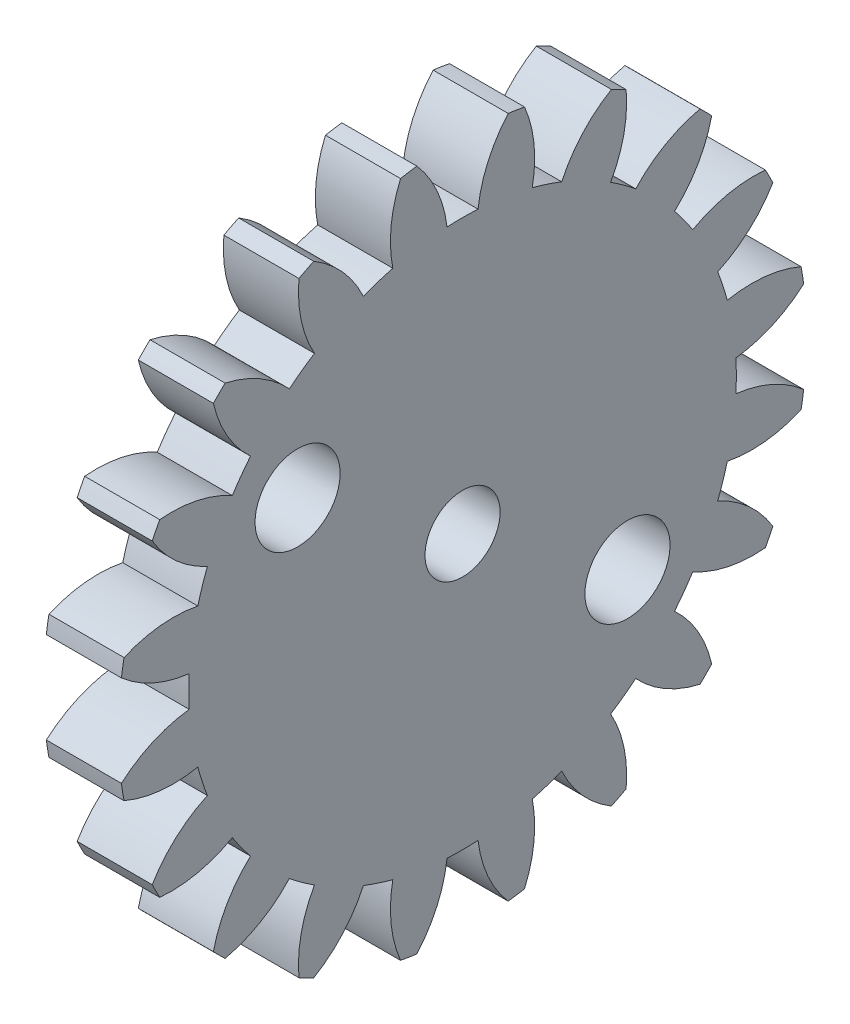
from build123d import *

# Parameters (mm, degrees)
SPUR_START             = -34.654843931
SPUR_GEAR_AM_OUTLINE_R = 5
SPUR_GEAR_AM_DEPTH     = 6
BOSS_EXTRUDE1_START    = -6
SKETCH2_R              = 5
SKETCH2_R_2            = 3
BOSS_EXTRUDE1_DEPTH    = 6
CUT_EXTRUDE1_REACH     = 65.242
SKETCH3_R              = 3.4


# Read off the part's stored shape, not the designer's step: spur gear_am
with BuildPart() as part:
    # spur gear_am outline → spur gear_am (new body)
    with BuildSketch(Plane.YZ.offset(SPUR_START)):
        with BuildLine():
            ThreePointArc((-3.907949552, 51.357822977), (-4.560317936, 51.46921073), (-5.215177847, 51.564867598))
            ThreePointArc((-5.215177847, 51.564867598), (-6.830693003, 49.038493172), (-7.624540457, 46.146735372))
            ThreePointArc((-7.624540457, 46.146735372), (-8.862265725, 46.181781364), (-10.099990992, 46.146735372))
            ThreePointArc((-10.099990992, 46.146735372), (-10.893838446, 49.038493172), (-12.509353602, 51.564867598))
            ThreePointArc((-12.509353602, 51.564867598), (-13.164213513, 51.46921073), (-13.816581897, 51.357822977))
            ThreePointArc((-13.816581897, 51.357822977), (-14.572335481, 48.455876478), (-14.433726972, 45.460339024))
            ThreePointArc((-14.433726972, 45.460339024), (-15.62170346, 45.111191601), (-16.788020333, 44.69538274))
            ThreePointArc((-16.788020333, 44.69538274), (-18.436616432, 47.200295486), (-20.75375528, 49.103798708))
            ThreePointArc((-20.75375528, 49.103798708), (-21.347004468, 48.810460779), (-21.933022961, 48.502931813))
            ThreePointArc((-21.933022961, 48.502931813), (-21.755036547, 45.509475985), (-20.69754004, 42.703382954))
            ThreePointArc((-20.69754004, 42.703382954), (-21.719480333, 42.004219099), (-22.700221591, 41.248349637))
            ThreePointArc((-22.700221591, 41.248349637), (-25.042190262, 43.121219015), (-27.834135107, 44.215522876))
            ThreePointArc((-27.834135107, 44.215522876), (-28.307702207, 43.753217846), (-28.770007237, 43.279650746))
            ThreePointArc((-28.770007237, 43.279650746), (-27.675703376, 40.487705901), (-25.802833998, 38.145737231))
            ThreePointArc((-25.802833998, 38.145737231), (-26.558703459, 37.164995972), (-27.257867315, 36.143055679))
            ThreePointArc((-27.257867315, 36.143055679), (-30.063960346, 37.200552186), (-33.057416174, 37.3785386))
            ThreePointArc((-33.057416174, 37.3785386), (-33.36494514, 36.792520107), (-33.658283069, 36.199270919))
            ThreePointArc((-33.658283069, 36.199270919), (-31.754779846, 33.882132071), (-29.249867101, 32.233535972))
            ThreePointArc((-29.249867101, 32.233535972), (-29.665675962, 31.067219099), (-30.014823385, 29.879242611))
            ThreePointArc((-30.014823385, 29.879242611), (-33.010360839, 30.01785112), (-35.912307338, 29.262097536))
            ThreePointArc((-35.912307338, 29.262097536), (-36.023695091, 28.609729152), (-36.119351959, 27.954869241))
            ThreePointArc((-36.119351959, 27.954869241), (-33.592977533, 26.339354085), (-30.701219732, 25.545506631))
            ThreePointArc((-30.701219732, 25.545506631), (-30.736265724, 24.307781363), (-30.701219732, 23.070056096))
            ThreePointArc((-30.701219732, 23.070056096), (-33.592977533, 22.276208642), (-36.119351959, 20.660693486))
            ThreePointArc((-36.119351959, 20.660693486), (-36.023695091, 20.005833575), (-35.912307338, 19.353465191))
            ThreePointArc((-35.912307338, 19.353465191), (-33.010360839, 18.597711607), (-30.014823385, 18.736320117))
            ThreePointArc((-30.014823385, 18.736320117), (-29.665675962, 17.548343629), (-29.249867101, 16.382026755))
            ThreePointArc((-29.249867101, 16.382026755), (-31.754779846, 14.733430656), (-33.658283069, 12.416291808))
            ThreePointArc((-33.658283069, 12.416291808), (-33.36494514, 11.82304262), (-33.057416174, 11.237024127))
            ThreePointArc((-33.057416174, 11.237024127), (-30.063960346, 11.415010541), (-27.257867315, 12.472507048))
            ThreePointArc((-27.257867315, 12.472507048), (-26.558703459, 11.450566755), (-25.802833998, 10.469825497))
            ThreePointArc((-25.802833998, 10.469825497), (-27.675703376, 8.127856826), (-28.770007237, 5.335911981))
            ThreePointArc((-28.770007237, 5.335911981), (-28.307702207, 4.862344881), (-27.834135107, 4.400039851))
            ThreePointArc((-27.834135107, 4.400039851), (-25.042190262, 5.494343712), (-22.700221591, 7.36721309))
            ThreePointArc((-22.700221591, 7.36721309), (-21.719480333, 6.611343629), (-20.69754004, 5.912179773))
            ThreePointArc((-20.69754004, 5.912179773), (-21.755036547, 3.106086742), (-21.933022961, 0.112630914))
            ThreePointArc((-21.933022961, 0.112630914), (-21.347004468, -0.194898052), (-20.75375528, -0.488235981))
            ThreePointArc((-20.75375528, -0.488235981), (-18.436616432, 1.415267242), (-16.788020333, 3.920179987))
            ThreePointArc((-16.788020333, 3.920179987), (-15.62170346, 3.504371126), (-14.433726972, 3.155223703))
            ThreePointArc((-14.433726972, 3.155223703), (-14.572335481, 0.159686249), (-13.816581897, -2.742260249))
            ThreePointArc((-13.816581897, -2.742260249), (-13.164213513, -2.853648003), (-12.509353602, -2.949304871))
            ThreePointArc((-12.509353602, -2.949304871), (-10.893838446, -0.422930445), (-10.099990992, 2.468827356))
            ThreePointArc((-10.099990992, 2.468827356), (-8.862265725, 2.433781364), (-7.624540457, 2.468827356))
            ThreePointArc((-7.624540457, 2.468827356), (-6.830693003, -0.422930445), (-5.215177847, -2.949304871))
            ThreePointArc((-5.215177847, -2.949304871), (-4.560317936, -2.853648003), (-3.907949552, -2.742260249))
            ThreePointArc((-3.907949552, -2.742260249), (-3.152195968, 0.159686249), (-3.290804477, 3.155223703))
            ThreePointArc((-3.290804477, 3.155223703), (-2.102827989, 3.504371126), (-0.936511116, 3.920179987))
            ThreePointArc((-0.936511116, 3.920179987), (0.712084983, 1.415267242), (3.029223831, -0.488235981))
            ThreePointArc((3.029223831, -0.488235981), (3.622473019, -0.194898052), (4.208491512, 0.112630914))
            ThreePointArc((4.208491512, 0.112630914), (4.030505098, 3.106086742), (2.973008591, 5.912179773))
            ThreePointArc((2.973008591, 5.912179773), (3.994948884, 6.611343629), (4.975690142, 7.36721309))
            ThreePointArc((4.975690142, 7.36721309), (7.317658813, 5.494343712), (10.109603658, 4.400039851))
            ThreePointArc((10.109603658, 4.400039851), (10.583170758, 4.862344881), (11.045475788, 5.335911981))
            ThreePointArc((11.045475788, 5.335911981), (9.951171927, 8.127856826), (8.078302549, 10.469825497))
            ThreePointArc((8.078302549, 10.469825497), (8.83417201, 11.450566755), (9.533335866, 12.472507048))
            ThreePointArc((9.533335866, 12.472507048), (12.339428897, 11.415010541), (15.332884725, 11.237024127))
            ThreePointArc((15.332884725, 11.237024127), (15.640413691, 11.82304262), (15.93375162, 12.416291808))
            ThreePointArc((15.93375162, 12.416291808), (14.030248397, 14.733430656), (11.525335652, 16.382026755))
            ThreePointArc((11.525335652, 16.382026755), (11.941144513, 17.548343629), (12.290291936, 18.736320117))
            ThreePointArc((12.290291936, 18.736320117), (15.28582939, 18.597711607), (18.187775889, 19.353465191))
            ThreePointArc((18.187775889, 19.353465191), (18.299163642, 20.005833575), (18.39482051, 20.660693486))
            ThreePointArc((18.39482051, 20.660693486), (15.868446084, 22.276208642), (12.976688283, 23.070056096))
            ThreePointArc((12.976688283, 23.070056096), (13.011734276, 24.307781363), (12.976688283, 25.545506631))
            ThreePointArc((12.976688283, 25.545506631), (15.868446084, 26.339354085), (18.39482051, 27.954869241))
            ThreePointArc((18.39482051, 27.954869241), (18.299163642, 28.609729152), (18.187775889, 29.262097536))
            ThreePointArc((18.187775889, 29.262097536), (15.28582939, 30.01785112), (12.290291936, 29.879242611))
            ThreePointArc((12.290291936, 29.879242611), (11.941144513, 31.067219099), (11.525335652, 32.233535972))
            ThreePointArc((11.525335652, 32.233535972), (14.030248397, 33.882132071), (15.93375162, 36.199270919))
            ThreePointArc((15.93375162, 36.199270919), (15.640413691, 36.792520107), (15.332884725, 37.3785386))
            ThreePointArc((15.332884725, 37.3785386), (12.339428897, 37.200552186), (9.533335866, 36.143055679))
            ThreePointArc((9.533335866, 36.143055679), (8.83417201, 37.164995972), (8.078302549, 38.145737231))
            ThreePointArc((8.078302549, 38.145737231), (9.951171927, 40.487705901), (11.045475788, 43.279650746))
            ThreePointArc((11.045475788, 43.279650746), (10.583170758, 43.753217846), (10.109603658, 44.215522876))
            ThreePointArc((10.109603658, 44.215522876), (7.317658813, 43.121219015), (4.975690142, 41.248349637))
            ThreePointArc((4.975690142, 41.248349637), (3.994948884, 42.004219099), (2.973008591, 42.703382954))
            ThreePointArc((2.973008591, 42.703382954), (4.030505098, 45.509475985), (4.208491512, 48.502931813))
            ThreePointArc((4.208491512, 48.502931813), (3.622473019, 48.810460779), (3.029223831, 49.103798708))
            ThreePointArc((3.029223831, 49.103798708), (0.712084983, 47.200295486), (-0.936511116, 44.69538274))
            ThreePointArc((-0.936511116, 44.69538274), (-2.102827989, 45.111191601), (-3.290804477, 45.460339024))
            ThreePointArc((-3.290804477, 45.460339024), (-3.152195968, 48.455876478), (-3.907949552, 51.357822977))
        make_face()
        with Locations((-8.862265724, 24.307781364)):
            Circle(SPUR_GEAR_AM_OUTLINE_R, mode=Mode.SUBTRACT)
    extrude(amount=SPUR_GEAR_AM_DEPTH)

    # Sketch2 → Boss-Extrude1 (add)
    with BuildSketch(Plane(origin=(-28.654843931, 0, 0), x_dir=(0, 0, -1), z_dir=(1, 0, 0)).offset(BOSS_EXTRUDE1_START)):
        with Locations((-24.307781364, -8.862265724)):
            Circle(SKETCH2_R)
        with Locations((-24.307781364, -8.862265724)):
            Circle(SKETCH2_R_2, mode=Mode.SUBTRACT)
    extrude(amount=BOSS_EXTRUDE1_DEPTH)

    # Sketch3 → Cut-Extrude1 (cut, up to next)
    with BuildSketch(Plane.ZY.offset(34.654843931), mode=Mode.PRIVATE) as cut_extrude1_sk1:
        with Locations((37.487332659, 0.209637475)):
            Circle(SKETCH3_R)
    cut_extrude1_tool1 = extrude(cut_extrude1_sk1.sketch, amount=-CUT_EXTRUDE1_REACH, mode=Mode.PRIVATE) & part.part
    # Sketch3 → Cut-Extrude1 (cut, up to next)
    with BuildSketch(Plane.ZY.offset(34.654843931), mode=Mode.PRIVATE) as cut_extrude1_sk2:
        with Locations((11.128230068, -17.934168924)):
            Circle(SKETCH3_R)
    cut_extrude1_tool2 = extrude(cut_extrude1_sk2.sketch, amount=-CUT_EXTRUDE1_REACH, mode=Mode.PRIVATE) & part.part
    add(cut_extrude1_tool1.solids().sort_by_distance((-34.654844, 0.209637, 37.487333))[0], mode=Mode.SUBTRACT)
    add(cut_extrude1_tool2.solids().sort_by_distance((-34.654844, -17.934169, 11.12823))[0], mode=Mode.SUBTRACT)


solid = part.part
